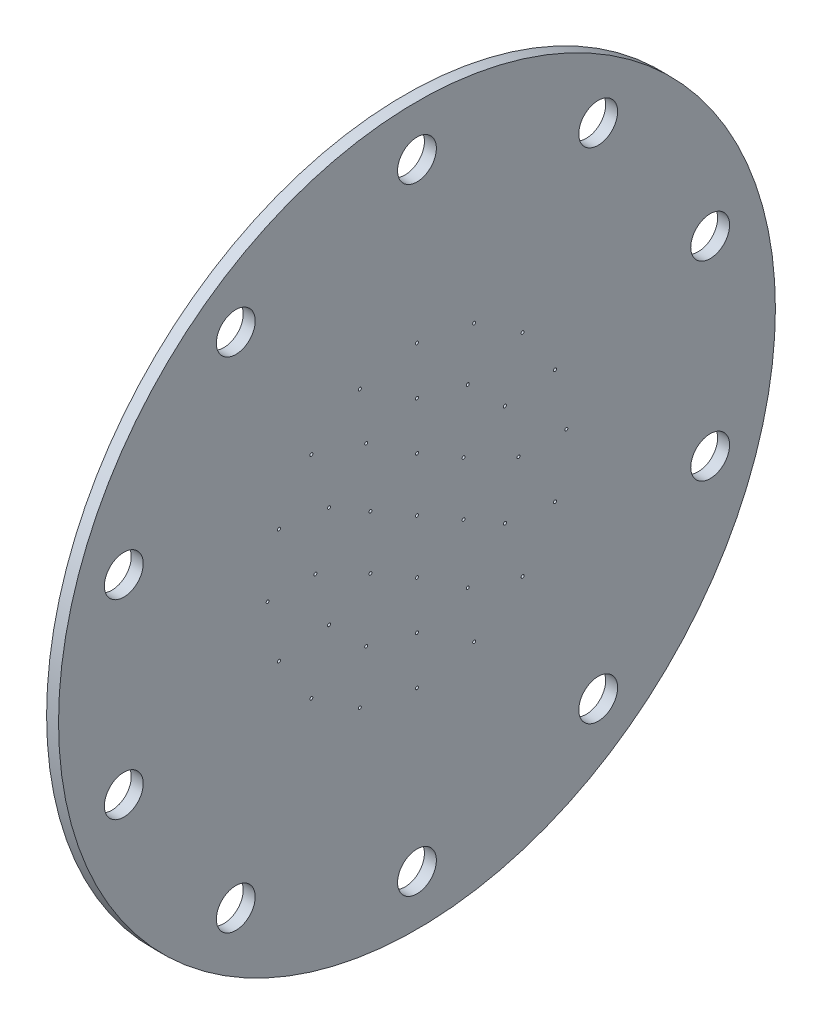
from build123d import *

# Parameters (mm, degrees)
SKETCH3_R          = 0.25
CUT_EXTRUDE1_DEPTH = 85.876380696
SKETCH4_R          = 3.25
CUT_EXTRUDE2_DEPTH = 10


with BuildPart() as part:
    # Sketch2 → Revolve1 (revolve)
    with BuildSketch(Plane.XY):
        Polygon((2, 0), (2, 31), (2, 60), (0, 60), (0, 0), align=None)
    revolve(axis=Axis((0, 0, 0), (1, 0, 0)))

    # Sketch3 → Cut-Extrude1 (cut, through all)
    with BuildSketch(Plane.ZY):
        Circle(SKETCH3_R)
        with Locations((0, 9)):
            Circle(SKETCH3_R)
        with Locations((0, 17)):
            Circle(SKETCH3_R)
        with Locations((0, 25)):
            Circle(SKETCH3_R)
        with Locations((7.794228634, 4.5)):
            Circle(SKETCH3_R)
        with Locations((7.794228634, -4.5)):
            Circle(SKETCH3_R)
        with Locations((0, -9)):
            Circle(SKETCH3_R)
        with Locations((-7.794228634, -4.5)):
            Circle(SKETCH3_R)
        with Locations((-7.794228634, 4.5)):
            Circle(SKETCH3_R)
        with Locations((8.5, 14.722431864)):
            Circle(SKETCH3_R)
        with Locations((14.722431864, 8.5)):
            Circle(SKETCH3_R)
        with Locations((17, 0)):
            Circle(SKETCH3_R)
        with Locations((14.722431864, -8.5)):
            Circle(SKETCH3_R)
        with Locations((8.5, -14.722431864)):
            Circle(SKETCH3_R)
        with Locations((0, -17)):
            Circle(SKETCH3_R)
        with Locations((-8.5, -14.722431864)):
            Circle(SKETCH3_R)
        with Locations((-14.722431864, -8.5)):
            Circle(SKETCH3_R)
        with Locations((-17, 0)):
            Circle(SKETCH3_R)
        with Locations((-14.722431864, 8.5)):
            Circle(SKETCH3_R)
        with Locations((-8.5, 14.722431864)):
            Circle(SKETCH3_R)
        with Locations((9.567085809, 23.096988313)):
            Circle(SKETCH3_R)
        with Locations((17.67766953, 17.67766953)):
            Circle(SKETCH3_R)
        with Locations((23.096988313, 9.567085809)):
            Circle(SKETCH3_R)
        with Locations((25, 0)):
            Circle(SKETCH3_R)
        with Locations((23.096988313, -9.567085809)):
            Circle(SKETCH3_R)
        with Locations((17.67766953, -17.67766953)):
            Circle(SKETCH3_R)
        with Locations((9.567085809, -23.096988313)):
            Circle(SKETCH3_R)
        with Locations((0, -25)):
            Circle(SKETCH3_R)
        with Locations((-9.567085809, -23.096988313)):
            Circle(SKETCH3_R)
        with Locations((-17.67766953, -17.67766953)):
            Circle(SKETCH3_R)
        with Locations((-23.096988313, -9.567085809)):
            Circle(SKETCH3_R)
        with Locations((-25, 0)):
            Circle(SKETCH3_R)
        with Locations((-23.096988313, 9.567085809)):
            Circle(SKETCH3_R)
        with Locations((-17.67766953, 17.67766953)):
            Circle(SKETCH3_R)
        with Locations((-9.567085809, 23.096988313)):
            Circle(SKETCH3_R)
    extrude(amount=-CUT_EXTRUDE1_DEPTH, mode=Mode.SUBTRACT)

    # Sketch4 → Cut-Extrude2 (cut)
    with BuildSketch(Plane.ZY):
        with Locations((0, 51.6)):
            Circle(SKETCH4_R)
        with Locations((30.329719018, 41.74527691)):
            Circle(SKETCH4_R)
        with Locations((49.074516241, 15.94527691)):
            Circle(SKETCH4_R)
        with Locations((49.074516241, -15.94527691)):
            Circle(SKETCH4_R)
        with Locations((30.329719018, -41.74527691)):
            Circle(SKETCH4_R)
        with Locations((0, -51.6)):
            Circle(SKETCH4_R)
        with Locations((-30.329719018, -41.74527691)):
            Circle(SKETCH4_R)
        with Locations((-49.074516241, -15.94527691)):
            Circle(SKETCH4_R)
        with Locations((-49.074516241, 15.94527691)):
            Circle(SKETCH4_R)
        with Locations((-30.329719018, 41.74527691)):
            Circle(SKETCH4_R)
    extrude(amount=-CUT_EXTRUDE2_DEPTH, mode=Mode.SUBTRACT)


solid = part.part
